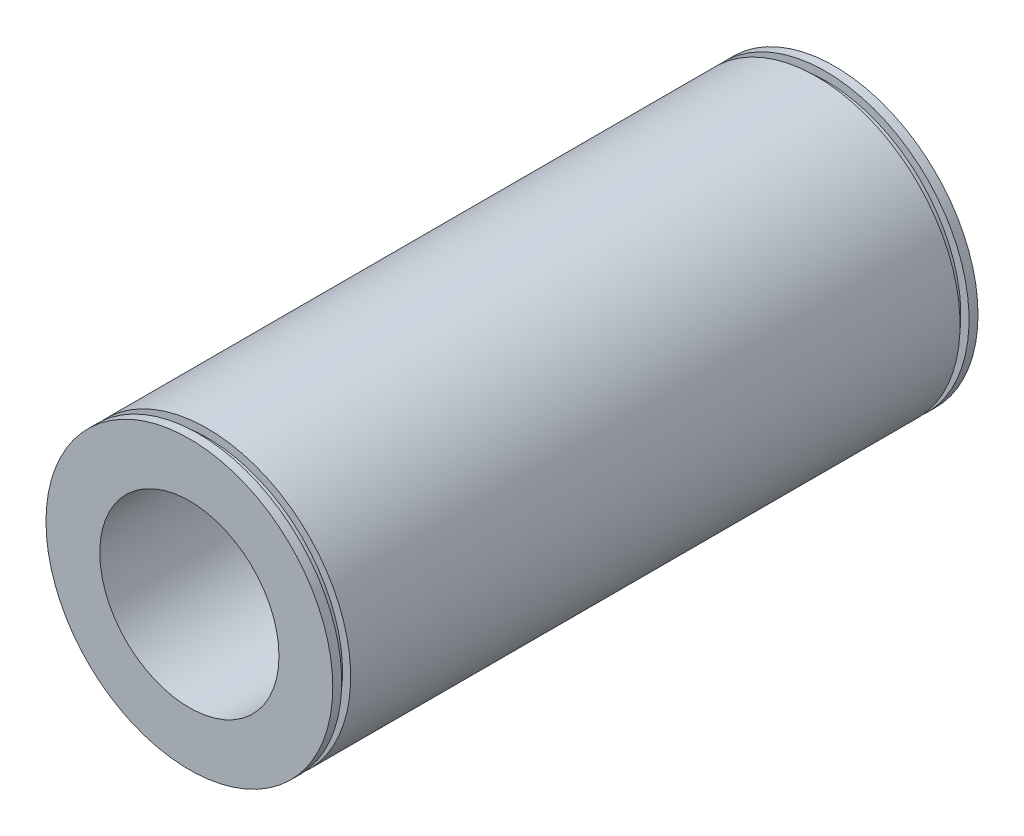
from build123d import *

# Parameters (mm, degrees)
SKETCH1_R           = 25.4
SKETCH1_R_2         = 15.875
BOSS_EXTRUDE1_DEPTH = 57.15
SKETCH2_W           = 1.5875
SKETCH2_H           = 1.4478


with BuildPart() as part:
    # Sketch1 → Boss-Extrude1 (new, symmetric)
    with BuildSketch(Plane.XY):
        Circle(SKETCH1_R)
        Circle(SKETCH1_R_2, mode=Mode.SUBTRACT)
    extrude(amount=BOSS_EXTRUDE1_DEPTH, both=True)

    # Sketch2 → Cut-Revolve1 (revolve, cut)
    with BuildSketch(Plane(origin=(0, 0, 0), x_dir=(0, 0, -1), z_dir=(1, 0, 0))):
        with Locations((-54.76875, 24.6761)):
            Rectangle(SKETCH2_W, SKETCH2_H)
    cut_revolve1 = revolve(axis=Axis((0, 0, 0), (0, 0, 1)), mode=Mode.SUBTRACT)

    # Mirror1: Cut-Revolve1 across plane
    add(cut_revolve1.mirror(Plane.XY), mode=Mode.SUBTRACT)


solid = part.part
